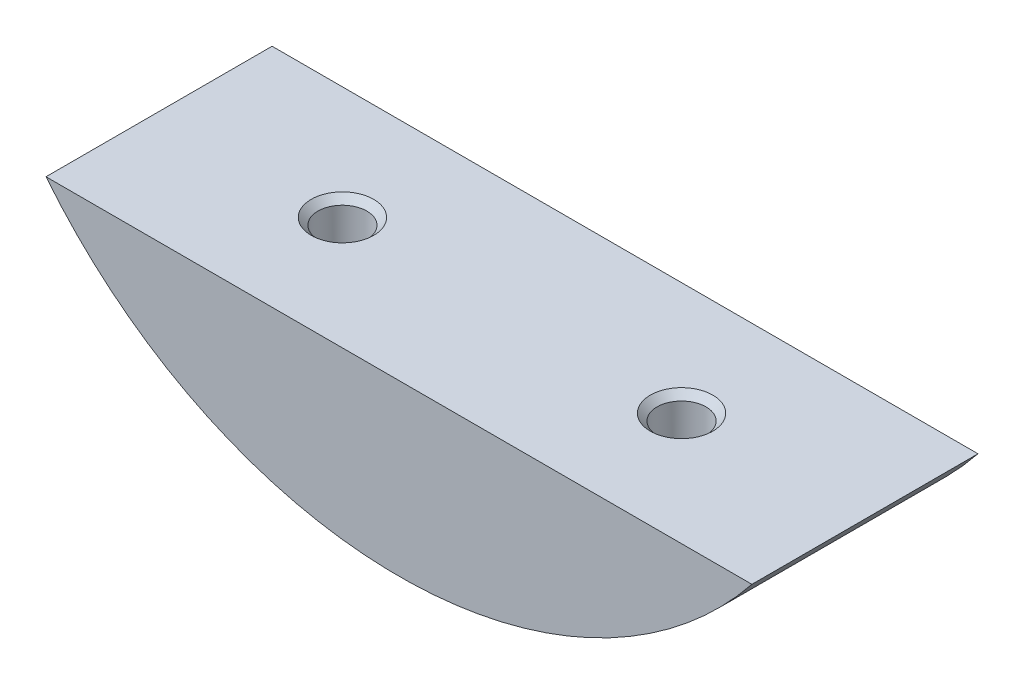
from build123d import *

# Parameters (mm, degrees)
BOSS_EXTRUDE1_DEPTH     = 25.4
CUT_EXTRUDE1_DEPTH      = 86.430512699
CUT_EXTRUDE1_DEPTH_BACK = 86.430512699
SKETCH2_R               = 2
SKETCH3_R               = 2.75
CUT_EXTRUDE2_DEPTH      = 5
CHAMFER1_SIZE           = 0.762


with BuildPart() as part:
    # Sketch1 → Boss-Extrude1 (new body)
    with BuildSketch(Plane.XY):
        with BuildLine():
            Line((0, 0), (79.31147458, 0))
            ThreePointArc((79.31147458, 0), (39.65573729, -19.05), (0, 0))
        make_face()
    extrude(amount=BOSS_EXTRUDE1_DEPTH)

    # Sketch2 → Cut-Extrude1 (cut, two sides: drawn at the far end of the back side and taken through both)
    with BuildSketch(Plane(origin=(0, 0, 0), x_dir=(1, 0, 0), z_dir=(0, 1, 0)).offset(-CUT_EXTRUDE1_DEPTH_BACK)):
        with Locations((20.60573729, -12.7)):
            Circle(SKETCH2_R)
        with Locations((58.70573729, -12.7)):
            Circle(SKETCH2_R)
    extrude(amount=CUT_EXTRUDE1_DEPTH + CUT_EXTRUDE1_DEPTH_BACK, mode=Mode.SUBTRACT)

    # Sketch3 → Cut-Extrude2 (cut)
    with BuildSketch(Plane(origin=(0, 0, 0), x_dir=(1, 0, 0), z_dir=(0, 1, 0))):
        with Locations((20.60573729, -12.7)):
            Circle(SKETCH3_R)
        with Locations((58.70573729, -12.7)):
            Circle(SKETCH3_R)
    extrude(amount=-CUT_EXTRUDE2_DEPTH, mode=Mode.SUBTRACT)

    # Chamfer1
    chamfer1_edges = [part.edges().sort_by_distance(p)[0] for p in [
        (17.85573729, 0, 12.7),
        (55.95573729, 0, 12.7),
    ]]
    chamfer(chamfer1_edges, length=CHAMFER1_SIZE)


solid = part.part
